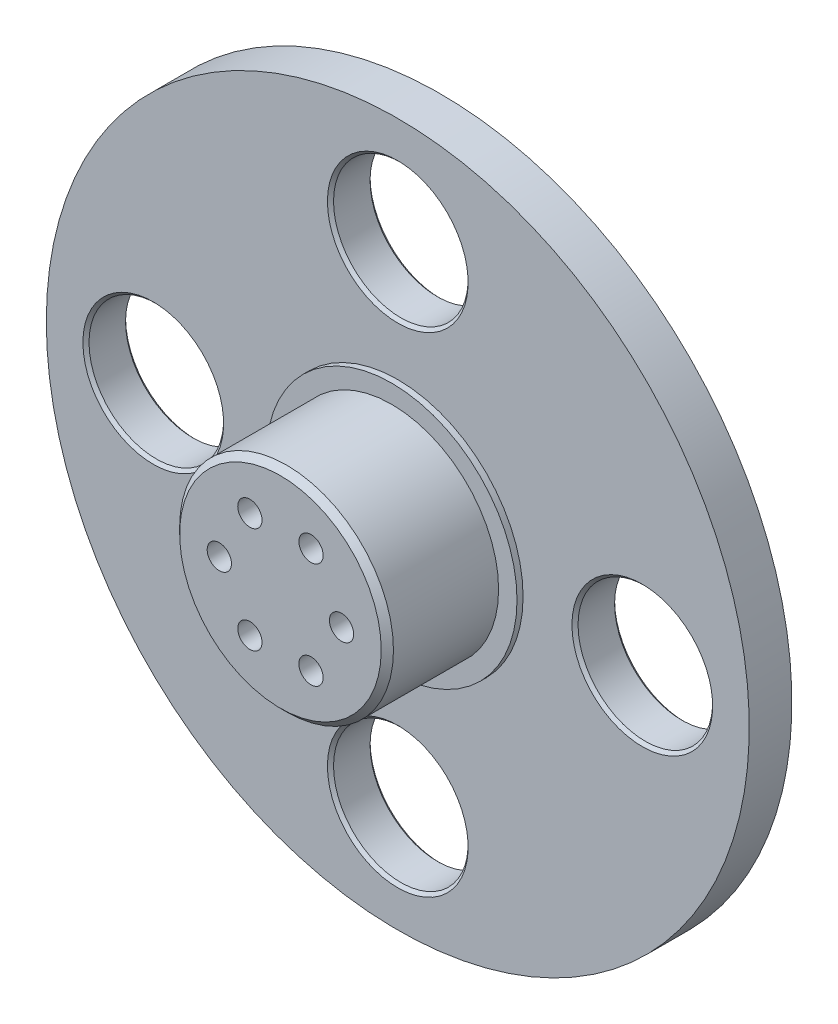
from build123d import *

# Parameters (mm, degrees)
SKETCH1_R                    = 17.49
BOSS_EXTRUDE1_DEPTH          = 18.2
SKETCH7_R                    = 20.5
BOSS_EXTRUDE3_DEPTH          = 0.995
SKETCH3_R                    = 57.5
BOSS_EXTRUDE2_DEPTH          = 6.975
SKETCH4_R                    = 11.015
CUT_EXTRUDE1_DEPTH           = 7
SKETCH5_R                    = 7.5
CUT_EXTRUDE2_DEPTH           = 0.5
SKETCH6_R                    = 1.985
CUT_EXTRUDE3_DEPTH           = 10
CIRPATTERN1_COUNT            = 6
CHAMFER1_SIZE                = 1
SKETCH12_R                   = 11.01
CUT_EXTRUDE7_DEPTH           = 84.552067748
CHAMFER5_SIZE                = 0.5
CIRPATTERN4_COUNT            = 4
CHAMFER5_OF_CIRPATTERN4_SIZE = 0.5


with BuildPart() as part:
    # Sketch1 → Boss-Extrude1 (new body)
    with BuildSketch(Plane.XY):
        Circle(SKETCH1_R)
    extrude(amount=BOSS_EXTRUDE1_DEPTH)

    # Sketch7 → Boss-Extrude3 (add)
    with BuildSketch(Plane(origin=(0, 0, 0), x_dir=(-1, 0, 0), z_dir=(0, 0, -1))):
        Circle(SKETCH7_R)
    extrude(amount=BOSS_EXTRUDE3_DEPTH)

    # Sketch3 → Boss-Extrude2 (add)
    with BuildSketch(Plane(origin=(0, 0, -0.995), x_dir=(-1, 0, 0), z_dir=(0, 0, -1))):
        Circle(SKETCH3_R)
    extrude(amount=BOSS_EXTRUDE2_DEPTH)

    # Sketch4 → Cut-Extrude1 (cut)
    with BuildSketch(Plane(origin=(0, 0, -7.97), x_dir=(-1, 0, 0), z_dir=(0, 0, -1))):
        Circle(SKETCH4_R)
    extrude(amount=-CUT_EXTRUDE1_DEPTH, mode=Mode.SUBTRACT)

    # Sketch5 → Cut-Extrude2 (cut)
    with BuildSketch(Plane(origin=(0, 0, -0.97), x_dir=(-1, 0, 0), z_dir=(0, 0, -1))):
        Circle(SKETCH5_R)
    extrude(amount=-CUT_EXTRUDE2_DEPTH, mode=Mode.SUBTRACT)

    # Sketch6 → Cut-Extrude3 (cut)
    with BuildSketch(Plane.XY.offset(18.2)):
        with Locations((-10, 0)):
            Circle(SKETCH6_R)
    cut_extrude3 = extrude(amount=-CUT_EXTRUDE3_DEPTH, mode=Mode.SUBTRACT)

    # CirPattern1: Cut-Extrude3 ×6 about axis
    cirpattern1_axis = Axis((0, 0, 18.2), (0, 0, 1))
    for i in range(1, CIRPATTERN1_COUNT):
        add(cut_extrude3.rotate(cirpattern1_axis, i * 360 / CIRPATTERN1_COUNT), mode=Mode.SUBTRACT)

    # Chamfer1
    chamfer1_edges = [part.edges().sort_by_distance(p)[0] for p in [
        (11.015, 0, -7.97),
        (-17.49, 0, 18.2),
    ]]
    chamfer(chamfer1_edges, length=CHAMFER1_SIZE)

    # Sketch12 → Cut-Extrude7 (cut, through all)
    with BuildSketch(Plane.XY.offset(-0.995)):
        with Locations((-40, 0)):
            Circle(SKETCH12_R)
    cut_extrude7 = extrude(amount=-CUT_EXTRUDE7_DEPTH, mode=Mode.SUBTRACT)

    # Chamfer5
    chamfer5_edges = [part.edges().sort_by_distance(p)[0] for p in [
        (-51.01, 0, -7.97),
        (-51.01, 0, -0.995),
    ]]
    chamfer(chamfer5_edges, length=CHAMFER5_SIZE)

    # CirPattern4: Cut-Extrude7 ×4 about axis
    cirpattern4_axis = Axis((0, 0, -7.97), (0, 0, 1))
    for i in range(1, CIRPATTERN4_COUNT):
        add(cut_extrude7.rotate(cirpattern4_axis, i * 360 / CIRPATTERN4_COUNT), mode=Mode.SUBTRACT)

    # Chamfer5 of CirPattern4
    chamfer5_of_cirpattern4_edges = [part.edges().sort_by_distance(p)[0] for p in [
        (0, -51.01, -7.97),
        (0, -51.01, -0.995),
        (51.01, 0, -7.97),
        (51.01, 0, -0.995),
        (0, 51.01, -7.97),
        (0, 51.01, -0.995),
    ]]
    chamfer(chamfer5_of_cirpattern4_edges, length=CHAMFER5_OF_CIRPATTERN4_SIZE)


solid = part.part
